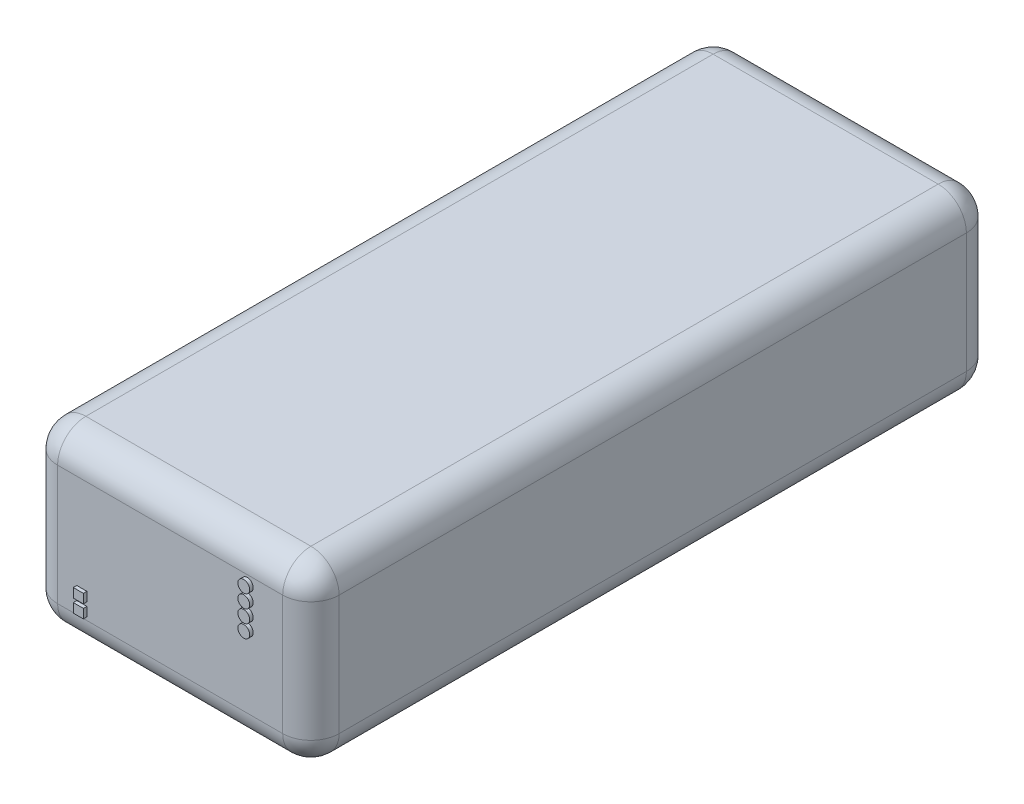
from build123d import *

# Parameters (mm, degrees)
SKETCH1_W           = 39.899654891
SKETCH1_H           = 96.899161878
BOSS_EXTRUDE1_DEPTH = 25
FILLET4_R           = 4
FILLET5_R           = 4
SKETCH11_R          = 0.836574299
SKETCH11_W          = 1.425486882
SKETCH11_H          = 1.295897166
BOSS_EXTRUDE2_DEPTH = 0.5


with BuildPart() as part:
    # Sketch1 → Boss-Extrude1 (new body)
    with BuildSketch(Plane(origin=(0, 0, 0), x_dir=(1, 0, 0), z_dir=(0, 1, 0))):
        with Locations((-40.909991022, 17.297585728)):
            Rectangle(SKETCH1_W, SKETCH1_H)
    extrude(amount=BOSS_EXTRUDE1_DEPTH)

    # Fillet4
    fillet4_edges = [part.edges().sort_by_distance(p)[0] for p in [
        (-20.960163576, 25, -17.297585728),
        (-40.909991022, 25, -65.747166667),
        (-60.859818467, 25, -17.297585728),
        (-40.909991022, 0, -65.747166667),
        (-20.960163576, 0, -17.297585728),
        (-40.909991022, 0, 31.151995211),
        (-60.859818467, 0, -17.297585728),
        (-40.909991022, 25, 31.151995211),
    ]]
    fillet(fillet4_edges, radius=FILLET4_R)

    # Fillet5
    # the kernel refuses this fillet: 4 mm, written as the material it takes off along each edge
    with BuildSketch(Plane(origin=(-56.859818467, 4, -61.747166667), x_dir=(-1, 0, 0), z_dir=(0, 0, -1))) as fillet5_piece_1_section:
        Polygon((0, 0), (FILLET5_R, 0), (FILLET5_R, -FILLET5_R), (0, -FILLET5_R), align=None)
    fillet5_piece_1 = extrude(amount=FILLET5_R, mode=Mode.PRIVATE)
    fillet5_piece_1 = fillet5_piece_1 - Plane(origin=(-56.859818467, 4, -61.747166667), x_dir=(0.7071067811865475, 0.7071067811865475, 0), z_dir=(0, 0, -1)) * Sphere(FILLET5_R, mode=Mode.PRIVATE)
    add(fillet5_piece_1, mode=Mode.SUBTRACT)
    with BuildSketch(Plane(origin=(-24.960163576, 4, -61.747166667), x_dir=(1, 0, 0), z_dir=(0, 0, -1))) as fillet5_piece_2_section:
        Polygon((0, 0), (FILLET5_R, 0), (FILLET5_R, FILLET5_R), (0, FILLET5_R), align=None)
    fillet5_piece_2 = extrude(amount=FILLET5_R, mode=Mode.PRIVATE)
    fillet5_piece_2 = fillet5_piece_2 - Plane(origin=(-24.960163576, 4, -61.747166667), x_dir=(-0.7071067811865475, 0.7071067811865475, 0), z_dir=(0, 0, -1)) * Sphere(FILLET5_R, mode=Mode.PRIVATE)
    add(fillet5_piece_2, mode=Mode.SUBTRACT)
    with BuildSketch(Plane(origin=(-56.859818467, 4, 27.151995211), x_dir=(0, 0, 1), z_dir=(-1, 0, 0))) as fillet5_piece_3_section:
        Polygon((0, 0), (FILLET5_R, 0), (FILLET5_R, -FILLET5_R), (0, -FILLET5_R), align=None)
    fillet5_piece_3 = extrude(amount=FILLET5_R, mode=Mode.PRIVATE)
    fillet5_piece_3 = fillet5_piece_3 - Plane(origin=(-56.859818467, 4, 27.151995211), x_dir=(0, 0.7071067811865475, -0.7071067811865475), z_dir=(-1, 0, 0)) * Sphere(FILLET5_R, mode=Mode.PRIVATE)
    add(fillet5_piece_3, mode=Mode.SUBTRACT)
    with BuildSketch(Plane(origin=(-24.960163576, 4, 27.151995211), x_dir=(0, 0, 1), z_dir=(1, 0, 0))) as fillet5_piece_4_section:
        Polygon((0, 0), (FILLET5_R, 0), (FILLET5_R, FILLET5_R), (0, FILLET5_R), align=None)
    fillet5_piece_4 = extrude(amount=FILLET5_R, mode=Mode.PRIVATE)
    fillet5_piece_4 = fillet5_piece_4 - Plane(origin=(-24.960163576, 4, 27.151995211), x_dir=(0, 0.7071067811865475, -0.7071067811865475), z_dir=(1, 0, 0)) * Sphere(FILLET5_R, mode=Mode.PRIVATE)
    add(fillet5_piece_4, mode=Mode.SUBTRACT)
    with BuildSketch(Plane(origin=(-24.960163576, 21, 27.151995211), x_dir=(0, 0, 1), z_dir=(1, 0, 0))) as fillet5_piece_5_section:
        Polygon((0, 0), (FILLET5_R, 0), (FILLET5_R, -FILLET5_R), (0, -FILLET5_R), align=None)
    fillet5_piece_5 = extrude(amount=FILLET5_R, mode=Mode.PRIVATE)
    fillet5_piece_5 = fillet5_piece_5 - Plane(origin=(-24.960163576, 21, 27.151995211), x_dir=(0, -0.7071067811865475, -0.7071067811865475), z_dir=(1, 0, 0)) * Sphere(FILLET5_R, mode=Mode.PRIVATE)
    add(fillet5_piece_5, mode=Mode.SUBTRACT)
    with BuildSketch(Plane(origin=(-56.859818467, 21, 27.151995211), x_dir=(0, 0, 1), z_dir=(-1, 0, 0))) as fillet5_piece_6_section:
        Polygon((0, 0), (FILLET5_R, 0), (FILLET5_R, FILLET5_R), (0, FILLET5_R), align=None)
    fillet5_piece_6 = extrude(amount=FILLET5_R, mode=Mode.PRIVATE)
    fillet5_piece_6 = fillet5_piece_6 - Plane(origin=(-56.859818467, 21, 27.151995211), x_dir=(0, -0.7071067811865475, -0.7071067811865475), z_dir=(-1, 0, 0)) * Sphere(FILLET5_R, mode=Mode.PRIVATE)
    add(fillet5_piece_6, mode=Mode.SUBTRACT)
    with BuildSketch(Plane(origin=(-24.960163576, 21, -61.747166667), x_dir=(1, 0, 0), z_dir=(0, 0, -1))) as fillet5_piece_7_section:
        Polygon((0, 0), (FILLET5_R, 0), (FILLET5_R, -FILLET5_R), (0, -FILLET5_R), align=None)
    fillet5_piece_7 = extrude(amount=FILLET5_R, mode=Mode.PRIVATE)
    fillet5_piece_7 = fillet5_piece_7 - Plane(origin=(-24.960163576, 21, -61.747166667), x_dir=(-0.7071067811865475, -0.7071067811865475, 0), z_dir=(0, 0, -1)) * Sphere(FILLET5_R, mode=Mode.PRIVATE)
    add(fillet5_piece_7, mode=Mode.SUBTRACT)
    with BuildSketch(Plane(origin=(-56.859818467, 21, -61.747166667), x_dir=(-1, 0, 0), z_dir=(0, 0, -1))) as fillet5_piece_8_section:
        Polygon((0, 0), (FILLET5_R, 0), (FILLET5_R, FILLET5_R), (0, FILLET5_R), align=None)
    fillet5_piece_8 = extrude(amount=FILLET5_R, mode=Mode.PRIVATE)
    fillet5_piece_8 = fillet5_piece_8 - Plane(origin=(-56.859818467, 21, -61.747166667), x_dir=(0.7071067811865475, -0.7071067811865475, 0), z_dir=(0, 0, -1)) * Sphere(FILLET5_R, mode=Mode.PRIVATE)
    add(fillet5_piece_8, mode=Mode.SUBTRACT)
    with BuildSketch(Plane(origin=(-20.960163576, 4, 31.151995211), x_dir=(0, 0, -1), z_dir=(0, 1, 0)), Plane(origin=(-20.960163576, 4, -65.747166667), x_dir=(-1, 0, 0), z_dir=(0, 1, 0))) as fillet5_piece_9:
        with BuildLine():
            CenterArc((FILLET5_R, FILLET5_R), FILLET5_R, 180, 90)
            Line((0, FILLET5_R), (0, 0))
            Line((0, 0), (FILLET5_R, 0))
        make_face()
    extrude(amount=17, mode=Mode.SUBTRACT)
    with BuildSketch(Plane(origin=(-60.859818467, 4, 31.151995211), x_dir=(0, 0, -1), z_dir=(0, 1, 0)), Plane(origin=(-60.859818467, 4, -65.747166667), x_dir=(1, 0, 0), z_dir=(0, 1, 0))) as fillet5_piece_10:
        with BuildLine():
            CenterArc((FILLET5_R, -FILLET5_R), FILLET5_R, 90, 90)
            Line((0, -FILLET5_R), (0, 0))
            Line((0, 0), (FILLET5_R, 0))
        make_face()
    extrude(amount=17, mode=Mode.SUBTRACT)

    # Sketch11 → Boss-Extrude2 (add)
    with BuildSketch(Plane.XY.offset(31.151995211)):
        with Locations(Location((-29.976452447, 19.823866424, 0), (0, 0, 180))):
            Circle(SKETCH11_R)
        with Locations(Location((-29.976452447, 17.95408771, 0), (0, 0, 180))):
            Circle(SKETCH11_R)
        with Locations(Location((-29.976452447, 14.298065843, 0), (0, 0, 180))):
            Circle(SKETCH11_R)
        with Locations(Location((-29.976452447, 16.144719304, 0), (0, 0, 180))):
            Circle(SKETCH11_R)
        with Locations((-53.429405659, 5.097195967)):
            Rectangle(SKETCH11_W, SKETCH11_H)
        with Locations((-53.429405659, 6.943849428)):
            Rectangle(SKETCH11_W, SKETCH11_H)
    extrude(amount=BOSS_EXTRUDE2_DEPTH)


solid = part.part
